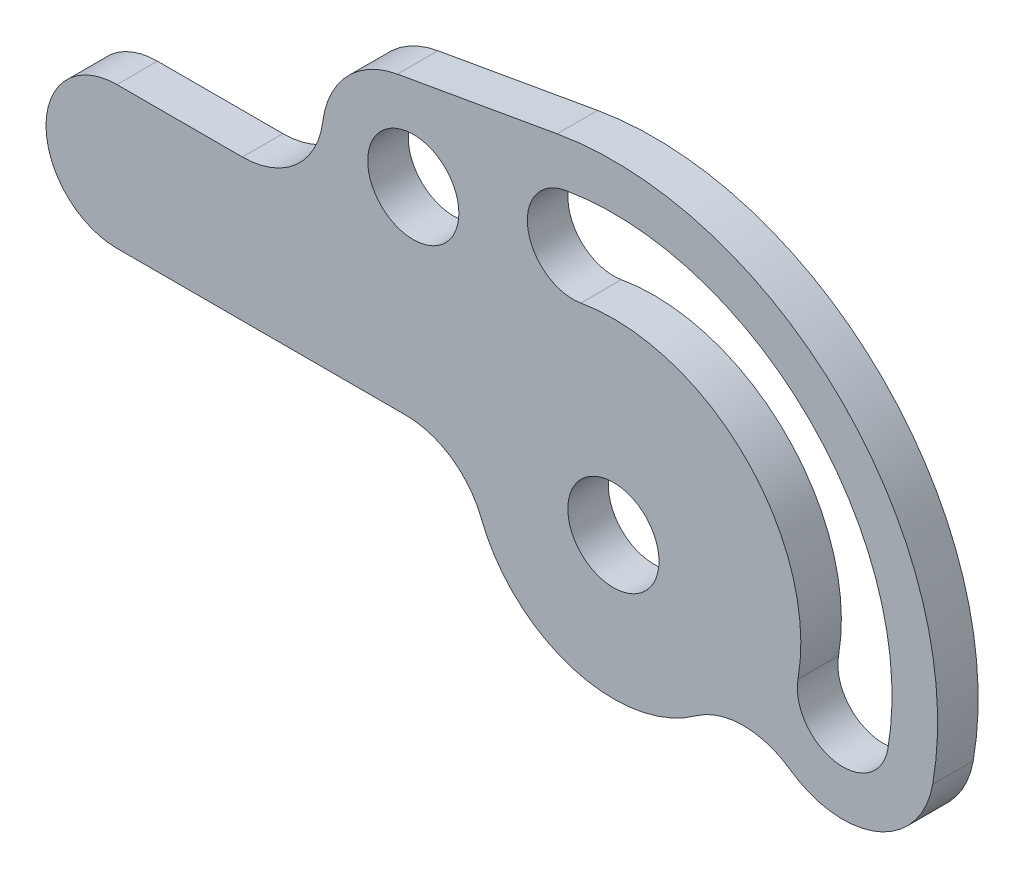
from build123d import *

# Parameters (mm, degrees)
SKETCH1_R           = 1.7859375
BOSS_EXTRUDE1_DEPTH = 1.5875
FILLET1_R           = 3.175


with BuildPart() as part:
    # Sketch1 → Boss-Extrude1 (new body)
    with BuildSketch(Plane.XY):
        with BuildLine():
            Line((-10.545438062, 5.55625), (-19.446875, 5.55625))
            ThreePointArc((-19.446875, 5.55625), (-22.225, 2.778125), (-19.446875, 0))
            Line((-19.446875, 0), (-5.55625, 0))
            ThreePointArc((-5.55625, 0), (-0.484259056, -5.535106795), (5.471838092, -0.964832608))
            ThreePointArc((5.471838092, -0.964832608), (8.369198647, -5.102692458), (12.507058463, -2.205331856))
            ThreePointArc((12.507058463, -2.205331856), (8.980256121, 8.980256121), (-2.205331856, 12.507058463))
            Line((-2.205331856, 12.507058463), (-8.458861088, 11.404392535))
            ThreePointArc((-8.458861088, 11.404392535), (-11.20276841, 9.087090354), (-10.545438062, 5.55625))
        make_face()
        with Locations((-7.838611503, 7.886782342)):
            Circle(SKETCH1_R, mode=Mode.SUBTRACT)
        with BuildLine():
            ThreePointArc((-1.895207064, 10.748253367), (7.717407604, 7.717407604), (10.748253367, -1.895207064))
            ThreePointArc((10.748253367, -1.895207064), (8.679323478, -3.343887368), (7.230643174, -1.274957479))
            ThreePointArc((7.230643174, -1.274957479), (5.19171057, 5.19171057), (-1.274957479, 7.230643174))
            ThreePointArc((-1.274957479, 7.230643174), (-3.343887368, 8.679323478), (-1.895207064, 10.748253367))
        make_face(mode=Mode.SUBTRACT)
        Circle(SKETCH1_R, mode=Mode.SUBTRACT)
    extrude(amount=BOSS_EXTRUDE1_DEPTH)

    # Fillet1
    fillet1_edges = [part.edges().sort_by_distance(p)[0] for p in [
        (-5.55625, 0, 0.79375),
        (-10.545438062, 5.55625, 0.79375),
    ]]
    fillet(fillet1_edges, radius=FILLET1_R)
    fillet1_2_edges = [part.edges().sort_by_distance(p)[0] for p in [
        (5.471838092, -0.964832608, 0.79375),
    ]]
    fillet(fillet1_2_edges, radius=FILLET1_R)


solid = part.part
